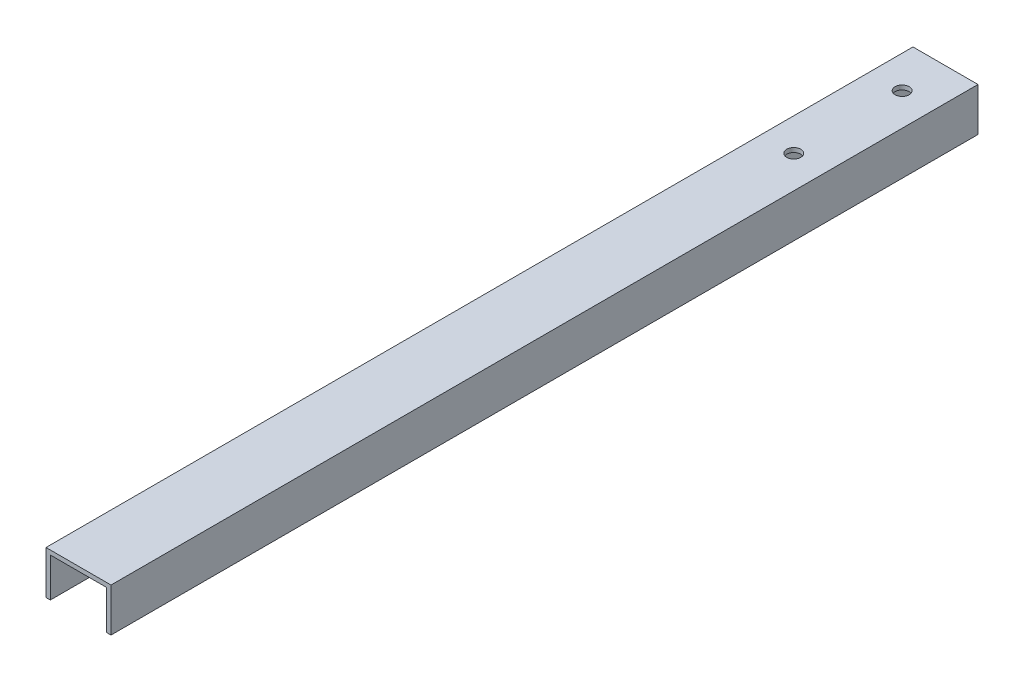
from build123d import *

# Parameters (mm, degrees)
BOSS_EXTRUDE1_DEPTH = 400
SKETCH2_R           = 3.25
CUT_EXTRUDE1_DEPTH  = 300


with BuildPart() as part:
    # Sketch1 → Boss-Extrude1 (new body)
    with BuildSketch(Plane.XY):
        Polygon((28, 0), (30, 0), (30, 20), (0, 20), (0, 0), (2, 0), (2, 18), (28, 18), align=None)
    extrude(amount=BOSS_EXTRUDE1_DEPTH)

    # Sketch2 → Cut-Extrude1 (cut)
    with BuildSketch(Plane(origin=(0, 20, 0), x_dir=(1, 0, 0), z_dir=(0, 1, 0))):
        with Locations((15, -70)):
            Circle(SKETCH2_R)
        with Locations((15, -20)):
            Circle(SKETCH2_R)
    extrude(amount=-CUT_EXTRUDE1_DEPTH, mode=Mode.SUBTRACT)


solid = part.part
